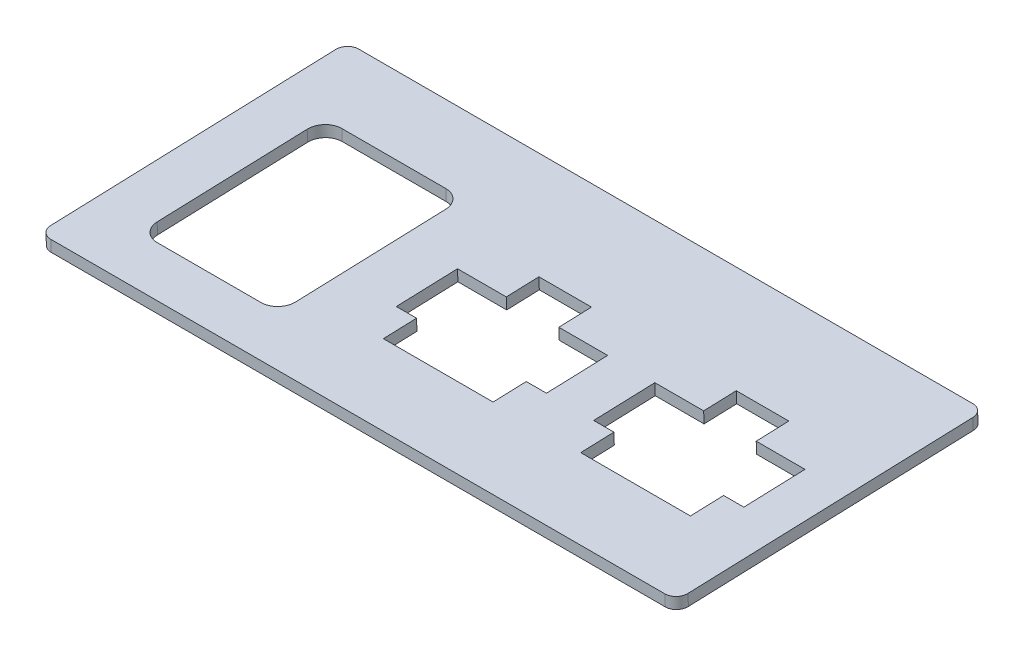
from build123d import *

# Parameters (mm, degrees)
SKETCH1_W           = 110.35
SKETCH1_H           = 53.357909186
BOSS_EXTRUDE1_DEPTH = 2
CUT_EXTRUDE1_REACH  = 75.899
FILLET1_R           = 2


with BuildPart() as part:
    # Sketch1 → Boss-Extrude1 (new body)
    with BuildSketch(Plane(origin=(0, -69.240689652, -2.417938163), x_dir=(1, 0, 0), z_dir=(0, 0.9993908270190958, 0.03489949670250105))):
        with Locations((0, 22.372057803)):
            Rectangle(SKETCH1_W, SKETCH1_H)
    extrude(amount=BOSS_EXTRUDE1_DEPTH)

    # Sketch2 → Cut-Extrude1 (cut, up to next)
    with BuildSketch(Plane(origin=(0, -69.240689652, -2.417938163), x_dir=(1, 0, 0), z_dir=(0, -0.9993908270190958, -0.03489949670250106)), mode=Mode.PRIVATE) as cut_extrude1_sk1:
        Polygon((-4.05, -25.472210096), (-4.05, -31.122210096), (5.05, -31.122210096), (5.05, -25.472210096), (13.5, -25.472210096), (13.5, -14.872210096), (10, -14.872210096), (10, -9.122210096), (-9, -9.122210096), (-9, -14.872210096), (-12.5, -14.872210096), (-12.5, -25.472210096), align=None)
    cut_extrude1_tool1 = extrude(cut_extrude1_sk1.sketch, amount=-CUT_EXTRUDE1_REACH, mode=Mode.PRIVATE) & part.part
    # Sketch2 → Cut-Extrude1 (cut, up to next)
    with BuildSketch(Plane(origin=(0, -69.240689652, -2.417938163), x_dir=(1, 0, 0), z_dir=(0, -0.9993908270190958, -0.03489949670250106)), mode=Mode.PRIVATE) as cut_extrude1_sk2:
        with BuildLine():
            Line((-43.175, -4.122210096), (-25.175, -4.122210096))
            ThreePointArc((-25.175, -4.122210096), (-23.053679656, -5.000889753), (-22.175, -7.122210096))
            Line((-22.175, -7.122210096), (-22.175, -33.122210096))
            ThreePointArc((-22.175, -33.122210096), (-23.053679656, -35.24353044), (-25.175, -36.122210096))
            Line((-25.175, -36.122210096), (-43.175, -36.122210096))
            ThreePointArc((-43.175, -36.122210096), (-45.296320344, -35.24353044), (-46.175, -33.122210096))
            Line((-46.175, -33.122210096), (-46.175, -7.122210096))
            ThreePointArc((-46.175, -7.122210096), (-45.296320344, -5.000889753), (-43.175, -4.122210096))
        make_face()
    cut_extrude1_tool2 = extrude(cut_extrude1_sk2.sketch, amount=-CUT_EXTRUDE1_REACH, mode=Mode.PRIVATE) & part.part
    # Sketch2 → Cut-Extrude1 (cut, up to next)
    with BuildSketch(Plane(origin=(0, -69.240689652, -2.417938163), x_dir=(1, 0, 0), z_dir=(0, -0.9993908270190958, -0.03489949670250106)), mode=Mode.PRIVATE) as cut_extrude1_sk3:
        Polygon((30.125, -25.472210096), (21.675, -25.472210096), (21.675, -14.872210096), (25.175, -14.872210096), (25.175, -9.122210096), (44.175, -9.122210096), (44.175, -14.872210096), (47.675, -14.872210096), (47.675, -25.472210096), (39.225, -25.472210096), (39.225, -31.122210096), (30.125, -31.122210096), align=None)
    cut_extrude1_tool3 = extrude(cut_extrude1_sk3.sketch, amount=-CUT_EXTRUDE1_REACH, mode=Mode.PRIVATE) & part.part
    add(cut_extrude1_tool1.solids().sort_by_distance((0.5, -68.574718, -21.488883))[0], mode=Mode.SUBTRACT)
    add(cut_extrude1_tool2.solids().sort_by_distance((-34.175, -68.538435, -22.52789))[0], mode=Mode.SUBTRACT)
    add(cut_extrude1_tool3.solids().sort_by_distance((34.675, -68.574718, -21.488883))[0], mode=Mode.SUBTRACT)

    # Fillet1
    fillet1_edges = [part.edges().sort_by_distance(p)[0] for p in [
        (-55.175, -68.391607355, 1.921234479),
        (55.175, -68.391607355, 1.921234479),
        (55.175, -66.529443179, -51.404170511),
        (-55.175, -66.529443179, -51.404170511),
    ]]
    fillet(fillet1_edges, radius=FILLET1_R)


solid = part.part
